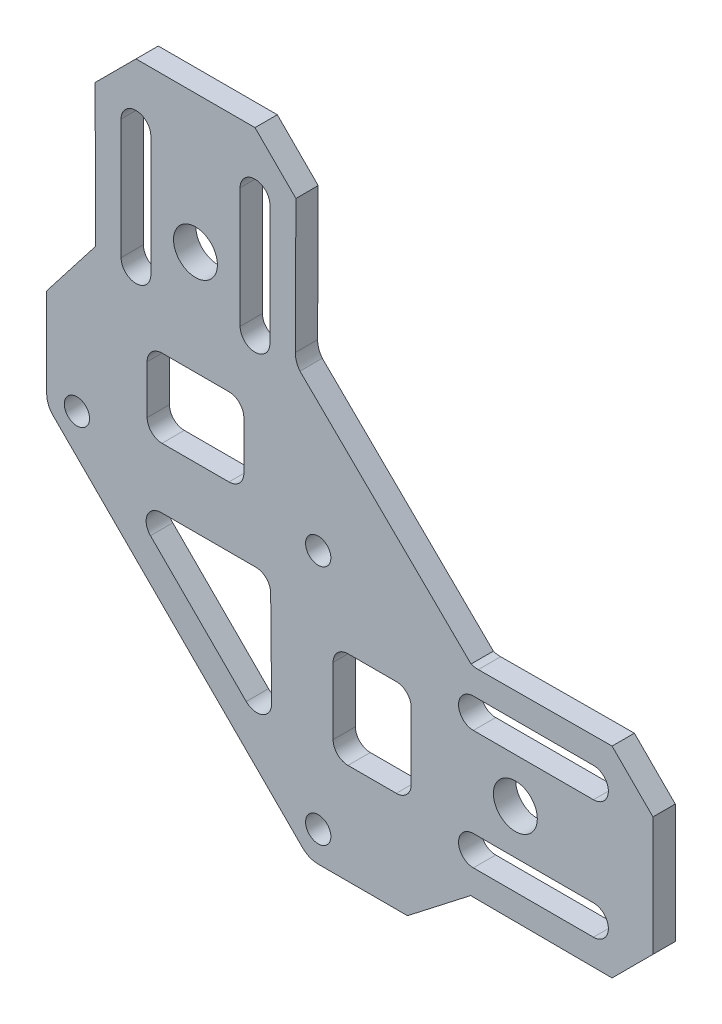
from build123d import *

# Parameters (mm, degrees)
SKETCH_1_W          = 40
SKETCH_1_H          = 48
EXTRUDE_1_DEPTH     = 3
CHAMFER_1_SIZE      = 12
SKETCH_2_R          = 2.95
SKETCH_2_W          = 13
SKETCH_2_H          = 10.5
CUT_EXTRUDE_1_DEPTH = 10
EXTRUDE_2_DEPTH     = 3
FILLET_1_R          = 2
CUT_EXTRUDE_3_DEPTH = 3
SKETCH_10_R         = 1.7
CUT_EXTRUDE_4_DEPTH = 3
SKETCH_12_R         = 1.7
SKETCH_12_R_2       = 2.95
EXTRUDE_4_DEPTH     = 3
FILLET_2_R          = 3
FILLET_3_R          = 13
FILLET_4_R          = 3
EXTRUDE_5_DEPTH     = 3
FILLET_5_R          = 2


with BuildPart() as part:
    # 草图1 → 凸台-拉伸1 (new body)
    with BuildSketch(Plane.XY):
        with Locations((20, 24)):
            Rectangle(SKETCH_1_W, SKETCH_1_H)
    extrude(amount=EXTRUDE_1_DEPTH)

    # 倒角1
    chamfer_1_edges = [part.edges().sort_by_distance(p)[0] for p in [
        (0, 48, 1.5),
        (40, 48, 1.5),
    ]]
    chamfer(chamfer_1_edges, length=CHAMFER_1_SIZE)

    # 草图2 → 切除-拉伸1 (cut)
    with BuildSketch(Plane(origin=(0, 0, 0), x_dir=(-1, 0, 0), z_dir=(0, 0, -1))):
        with Locations((-20, 29.5)):
            Circle(SKETCH_2_R)
        with BuildLine():
            Line((-6.676784368, 4.473797691), (-6.5, 42.5))
            Line((-6.5, 42.5), (0, 36))
            Line((0, 36), (0, 0))
            Line((0, 0), (-1.349561874, 1.722051065))
            ThreePointArc((-1.349561874, 1.722051065), (-2.686952607, 5.665410674), (-6.676784368, 4.473797691))
        make_face()
        with BuildLine():
            Line((-33.5, 42.5), (-40, 36))
            Line((-40, 36), (-40, 0))
            Line((-40, 0), (-38.650438126, 1.722051065))
            ThreePointArc((-38.650438126, 1.722051065), (-37.313047393, 5.665410674), (-33.323215632, 4.473797691))
            Line((-33.323215632, 4.473797691), (-33.5, 42.5))
        make_face()
        with Locations((-20, 10.25)):
            Rectangle(SKETCH_2_W, SKETCH_2_H)
    extrude(amount=-CUT_EXTRUDE_1_DEPTH, mode=Mode.SUBTRACT)

    # 草图6 → 凸台-拉伸2 (add)
    with BuildSketch(Plane.XY.offset(3)):
        Polygon((0, 0), (0, 15), (6.588392184, 23.486898846), (6.676784368, 4.473797691), (1.450726441, 4.473797691), (1.450726441, 0), align=None)
        Polygon((40, 15), (33.411607816, 23.486898846), (33.323215632, 4.473797691), (38.549273559, 4.473797691), (38.549273559, 0), (40, 0), align=None)
    extrude(amount=-EXTRUDE_2_DEPTH)

    # 圆角1
    fillet_1_edges = [part.edges().sort_by_distance(p)[0] for p in [
        (13.5, 15.5, 1.5),
        (13.5, 5, 1.5),
        (26.5, 5, 1.5),
        (26.5, 15.5, 1.5),
    ]]
    fillet(fillet_1_edges, radius=FILLET_1_R)

    # 草图7 → 切除-拉伸3 (cut)
    with BuildSketch(Plane.XY.offset(3)):
        with BuildLine():
            Line((14, 40), (14, 23.857322167))
            ThreePointArc((14, 23.857322167), (12, 21.857322167), (10, 23.857322167))
            Line((10, 23.857322167), (10, 40))
            ThreePointArc((10, 40), (12, 42), (14, 40))
        make_face()
        with BuildLine():
            Line((26, 40), (26, 23.857322167))
            ThreePointArc((26, 23.857322167), (28, 21.857322167), (30, 23.857322167))
            Line((30, 23.857322167), (30, 40))
            ThreePointArc((30, 40), (28, 42), (26, 40))
        make_face()
    extrude(amount=-CUT_EXTRUDE_3_DEPTH, mode=Mode.SUBTRACT)

    # 草图10 → 切除-拉伸4 (cut)
    with BuildSketch(Plane(origin=(0, 0, 0), x_dir=(-1, 0, 0), z_dir=(0, 0, -1))):
        with Locations((-4.063755404, 3)):
            Circle(SKETCH_10_R)
        with Locations((-36.5, 3)):
            Circle(SKETCH_10_R)
    extrude(amount=-CUT_EXTRUDE_4_DEPTH, mode=Mode.SUBTRACT)

    # 草图12 → 凸台-拉伸4 (add)
    with BuildSketch(Plane.XY.offset(3)):
        Polygon((33.5, 0), (33.5, -33.5), (48.5, -33.5), (56.986898846, -26.911607816), (76, -27), (81.5, -21.5), (81.5, -5.5), (76, 0), (56.986898846, -0.088392184), (48.5, 6.5), (40, 6.5), (40, 0), align=None)
        with Locations((36.5, -29.436244596)):
            Circle(SKETCH_12_R, mode=Mode.SUBTRACT)
        with BuildLine():
            ThreePointArc((40.5, -20), (39.085786438, -19.414213562), (38.5, -18))
            Line((38.5, -18), (38.5, -9))
            ThreePointArc((38.5, -9), (39.085786438, -7.585786438), (40.5, -7))
            Line((40.5, -7), (47, -7))
            ThreePointArc((47, -7), (48.414213562, -7.585786438), (49, -9))
            Line((49, -9), (49, -18))
            ThreePointArc((49, -18), (48.414213562, -19.414213562), (47, -20))
            Line((47, -20), (40.5, -20))
        make_face(mode=Mode.SUBTRACT)
        with BuildLine():
            ThreePointArc((73.5, -19.5), (75.5, -21.5), (73.5, -23.5))
            Line((73.5, -23.5), (57.357322167, -23.5))
            ThreePointArc((57.357322167, -23.5), (55.357322167, -21.5), (57.357322167, -19.5))
            Line((57.357322167, -19.5), (73.5, -19.5))
        make_face(mode=Mode.SUBTRACT)
        with Locations((63, -13.5)):
            Circle(SKETCH_12_R_2, mode=Mode.SUBTRACT)
        with BuildLine():
            ThreePointArc((57.357322167, -7.5), (55.357322167, -5.5), (57.357322167, -3.5))
            Line((57.357322167, -3.5), (73.5, -3.5))
            ThreePointArc((73.5, -3.5), (75.5, -5.5), (73.5, -7.5))
            Line((73.5, -7.5), (57.357322167, -7.5))
        make_face(mode=Mode.SUBTRACT)
    extrude(amount=-EXTRUDE_4_DEPTH)

    # 圆角2
    fillet_2_edges = [part.edges().sort_by_distance(p)[0] for p in [
        (33.5, -33.5, 1.5),
        (33.5, 0, 1.5),
        (0, 0, 1.5),
    ]]
    fillet(fillet_2_edges, radius=FILLET_2_R)

    # 圆角3
    # the kernel refuses this fillet: 13 mm, written as the material it adds along each edge
    with BuildSketch(Plane(origin=(40, 6.5, 3), x_dir=(0, 1, 0), z_dir=(0, 0, -1))) as fillet_3_piece_1:
        with BuildLine():
            CenterArc((12.400920193, 12.400920193), FILLET_3_R, 197.46185463, 55.076290741)
            Line((0, 8.5), (0, 0))
            Line((0, 0), (8.5, 0))
        make_face()
    extrude(amount=3)

    # 圆角4
    fillet_4_edges = [part.edges().sort_by_distance(p)[0] for p in [
        (33.411607816, 23.486898846, 1.5),
        (56.986898846, -0.088392184, 1.5),
    ]]
    fillet(fillet_4_edges, radius=FILLET_4_R)

    # 草图13 → 凸台-拉伸5 (add)
    # profile 1 of 2: a face of its own
    with BuildSketch(Plane.XY.offset(3)):
        Polygon((34.046638715, 22.66887787), (57.042815657, 0.076069922), (39.491091869, 6.043623433), align=None)
    # profile 2 of 2: a face of its own
    with BuildSketch(Plane.XY.offset(3)):
        Polygon((0.878679656, 0.878679656), (34.378679656, -32.621320344), (34.046638715, 0.878679656), align=None)
        Polygon((10.535533906, -3.121320344), (30.281807462, -22.8675939), (30.086088917, -3.121320344), align=None, mode=Mode.SUBTRACT)
    extrude(amount=-EXTRUDE_5_DEPTH)

    # 圆角5
    fillet_5_edges = [part.edges().sort_by_distance(p)[0] for p in [
        (30.086088917, -3.121320344, 1.5),
        (30.281807462, -22.8675939, 1.5),
        (10.535533906, -3.121320344, 1.5),
    ]]
    fillet(fillet_5_edges, radius=FILLET_5_R)


solid = part.part
